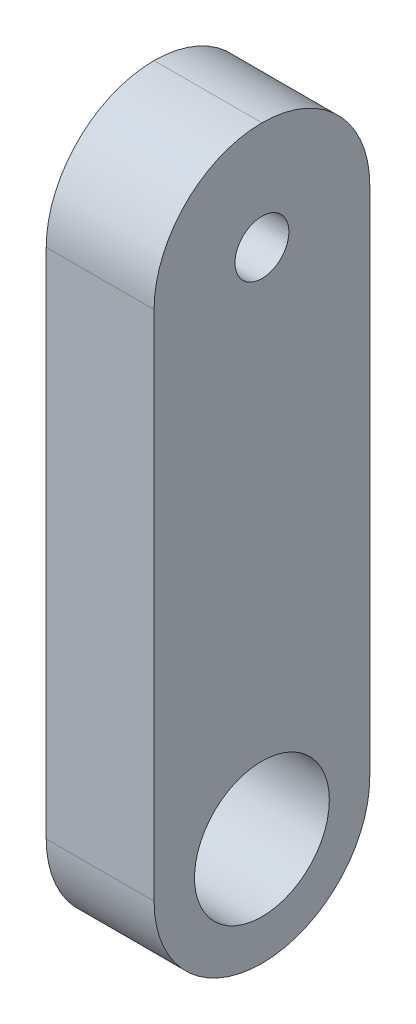
from build123d import *

# Parameters (mm, degrees)
SKETCH1_W           = 8
SKETCH1_H           = 27
BOSS_EXTRUDE1_DEPTH = 4
SKETCH2_R           = 2.5
SKETCH2_R_2         = 1
CUT_EXTRUDE1_DEPTH  = 29.442925307
FILLET1_R           = 4


with BuildPart() as part:
    # Sketch1 → Boss-Extrude1 (new body)
    with BuildSketch(Plane(origin=(0, 0, 0), x_dir=(0, 0, -1), z_dir=(1, 0, 0))):
        with Locations((4, -13.5)):
            Rectangle(SKETCH1_W, SKETCH1_H)
    extrude(amount=BOSS_EXTRUDE1_DEPTH)

    # Sketch2 → Cut-Extrude1 (cut, through all)
    with BuildSketch(Plane(origin=(4, 0, 0), x_dir=(0, 0, -1), z_dir=(1, 0, 0))):
        with Locations((4, -23)):
            Circle(SKETCH2_R)
        with Locations((4, -4)):
            Circle(SKETCH2_R_2)
    extrude(amount=-CUT_EXTRUDE1_DEPTH, mode=Mode.SUBTRACT)

    # Fillet1
    fillet1_edges = [part.edges().sort_by_distance(p)[0] for p in [
        (2, -27, -8),
        (2, -27, 0),
        (2, 0, 0),
        (2, 0, -8),
    ]]
    fillet(fillet1_edges, radius=FILLET1_R - 0.0001)  # a hair under: the kernel refuses the full size


solid = part.part
